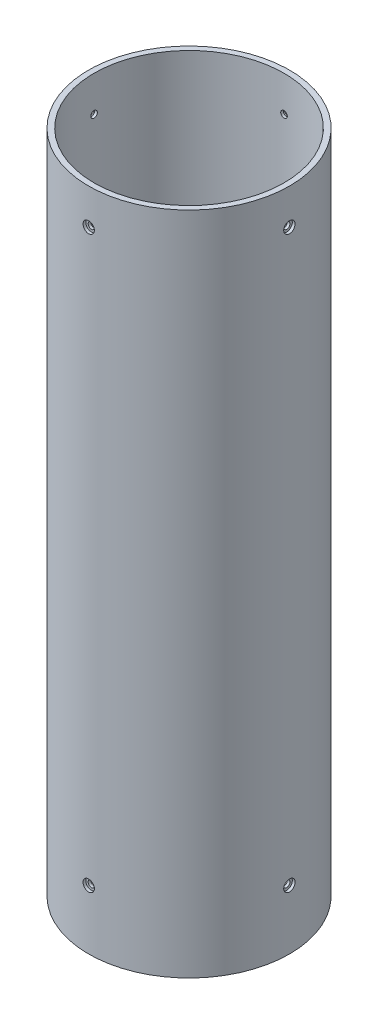
from build123d import *

# Parameters (mm, degrees)
SKETCH1_R                         = 53.721
SKETCH1_R_2                       = 50.8
BODY_EXTRUSION_DEPTH              = 355.6
UPPER_BULKHEAD_HOLES_REACH        = 377.341
SKETCH2_R                         = 1.7526
UPPER_BULKHEAD_HOLE_PATTERN_COUNT = 4
LOWER_BULKHEAD_HOLES_REACH        = 377.341
SKETCH3_R                         = 1.7526
LOWER_BULKHEAD_HOLE_PATTERN_COUNT = 4
SKETCH4_R                         = 3.0226
COUNTERSINK_DEPTH                 = 1.524
COUNTERSINK_PATTERN_COUNT         = 4


with BuildPart() as part:
    # Sketch1 → Body Extrusion (new body)
    with BuildSketch(Plane(origin=(0, 0, 0), x_dir=(1, 0, 0), z_dir=(0, 1, 0))):
        Circle(SKETCH1_R)
        Circle(SKETCH1_R_2, mode=Mode.SUBTRACT)
    extrude(amount=BODY_EXTRUSION_DEPTH)

    # Sketch2 → Upper Bulkhead Holes (cut, up to next)
    with BuildSketch(Plane.XY.offset(53.721), mode=Mode.PRIVATE) as upper_bulkhead_holes_sk1:
        with Locations((0, 336.55)):
            Circle(SKETCH2_R)
    upper_bulkhead_holes_tool1 = extrude(upper_bulkhead_holes_sk1.sketch, amount=-UPPER_BULKHEAD_HOLES_REACH, mode=Mode.PRIVATE) & part.part
    upper_bulkhead_holes = upper_bulkhead_holes_tool1.solids().sort_by_distance((0, 336.55, 53.721))[0]
    add(upper_bulkhead_holes, mode=Mode.SUBTRACT)

    # Upper Bulkhead Hole Pattern: Upper Bulkhead Holes ×4 about axis
    upper_bulkhead_hole_pattern_axis = Axis((0, 355.6, 0), (0, -1, 0))
    for i in range(1, UPPER_BULKHEAD_HOLE_PATTERN_COUNT):
        add(upper_bulkhead_holes.rotate(upper_bulkhead_hole_pattern_axis, i * 360 / UPPER_BULKHEAD_HOLE_PATTERN_COUNT), mode=Mode.SUBTRACT)

    # Sketch3 → Lower Bulkhead Holes (cut, up to next)
    with BuildSketch(Plane.XY.offset(53.721), mode=Mode.PRIVATE) as lower_bulkhead_holes_sk1:
        with Locations((0, 31.75)):
            Circle(SKETCH3_R)
    lower_bulkhead_holes_tool1 = extrude(lower_bulkhead_holes_sk1.sketch, amount=-LOWER_BULKHEAD_HOLES_REACH, mode=Mode.PRIVATE) & part.part
    lower_bulkhead_holes = lower_bulkhead_holes_tool1.solids().sort_by_distance((0, 31.75, 53.721))[0]
    add(lower_bulkhead_holes, mode=Mode.SUBTRACT)

    # Lower Bulkhead Hole Pattern: Lower Bulkhead Holes ×4 about axis
    lower_bulkhead_hole_pattern_axis = Axis((0, 355.6, 0), (0, -1, 0))
    for i in range(1, LOWER_BULKHEAD_HOLE_PATTERN_COUNT):
        add(lower_bulkhead_holes.rotate(lower_bulkhead_hole_pattern_axis, i * 360 / LOWER_BULKHEAD_HOLE_PATTERN_COUNT), mode=Mode.SUBTRACT)

    # Sketch4 → Countersink (cut)
    with BuildSketch(Plane.XY.offset(53.721)):
        with Locations((0, 336.55)):
            Circle(SKETCH4_R)
        with Locations((0, 31.75)):
            Circle(SKETCH4_R)
    countersink = extrude(amount=-COUNTERSINK_DEPTH, mode=Mode.SUBTRACT)

    # Countersink Pattern: Countersink ×4 about axis
    countersink_pattern_axis = Axis((0, 355.6, 0), (0, -1, 0))
    for i in range(1, COUNTERSINK_PATTERN_COUNT):
        add(countersink.rotate(countersink_pattern_axis, i * 360 / COUNTERSINK_PATTERN_COUNT), mode=Mode.SUBTRACT)


solid = part.part
